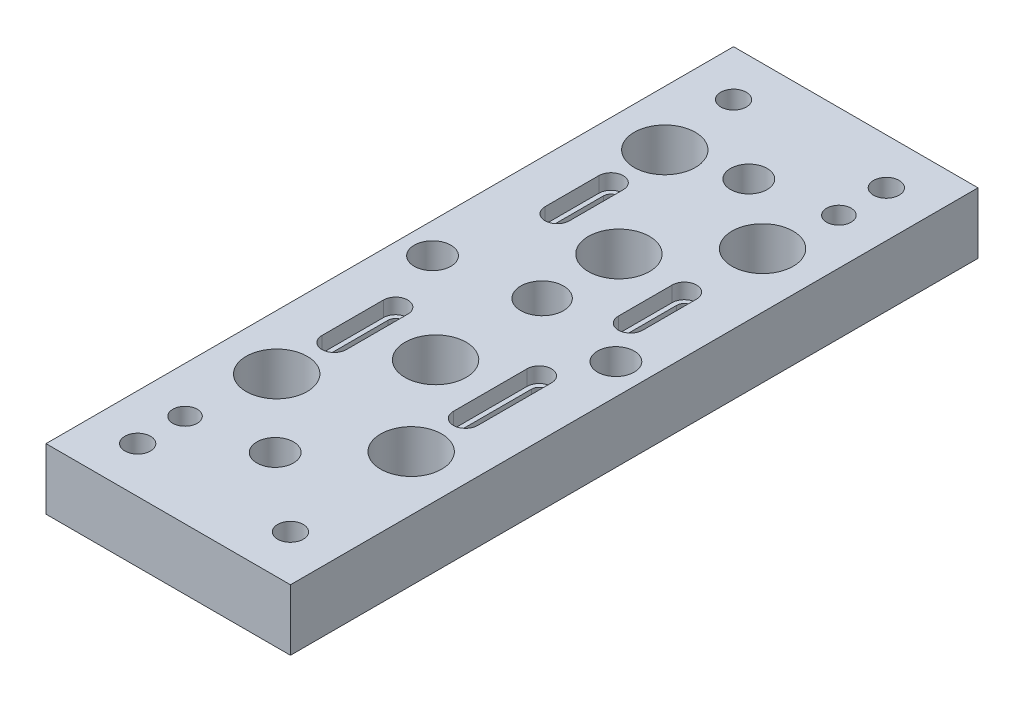
from build123d import *

# Parameters (mm, degrees)
SKETCH1_W                                    = 80
SKETCH1_H                                    = 225
BOSS_EXTRUDE1_DEPTH                          = 20
CUT_EXTRUDE1_REACH                           = 123.063
CUT_EXTRUDE2_DEPTH                           = 5
CBORE_FOR_M8_HEX_SOCKET_HEAD_CAP_SCR_2_COUNT = 2
CBORE_FOR_M8_HEX_SOCKET_HEAD_CAP_SCR_2_PITCH = 50
CBORE_FOR_M8_HEX_SOCKET_HEAD_CAP_SCR_3_COUNT = 2
CBORE_FOR_M8_HEX_SOCKET_HEAD_CAP_SCR_3_PITCH = 201.308221392
CBORE_FOR_M8_HEX_SOCKET_HEAD_CAP_SCR_4_COUNT = 2
CBORE_FOR_M8_HEX_SOCKET_HEAD_CAP_SCR_4_PITCH = 195
F_8_0MM_DOWEL_HOLE1_D                        = 8
SKETCH11_R                                   = 10
CUT_EXTRUDE3_DEPTH                           = 122.063000128
CUT_EXTRUDE4_REACH                           = 123.063
SKETCH13_R                                   = 6
CUT_EXTRUDE5_REACH                           = 123.063
SKETCH14_R                                   = 7


with BuildPart() as part:
    # Sketch1 → Boss-Extrude1 (new body)
    with BuildSketch(Plane(origin=(0, 0, 0), x_dir=(1, 0, 0), z_dir=(0, 1, 0))):
        Rectangle(SKETCH1_W, SKETCH1_H)
    extrude(amount=-BOSS_EXTRUDE1_DEPTH)

    # Sketch2 → Cut-Extrude1 (cut, up to next)
    with BuildSketch(Plane(origin=(0, 0, 0), x_dir=(1, 0, 0), z_dir=(0, 1, 0)), mode=Mode.PRIVATE) as cut_extrude1_sk1:
        with BuildLine():
            Line((24, 17.31), (24, 34.91))
            ThreePointArc((24, 34.91), (21.5, 37.41), (19, 34.91))
            Line((19, 34.91), (19, 17.31))
            ThreePointArc((19, 17.31), (21.5, 14.81), (24, 17.31))
        make_face()
    cut_extrude1_tool1 = extrude(cut_extrude1_sk1.sketch, amount=-CUT_EXTRUDE1_REACH, mode=Mode.PRIVATE) & part.part
    # Sketch2 → Cut-Extrude1 (cut, up to next)
    with BuildSketch(Plane(origin=(0, 0, 0), x_dir=(1, 0, 0), z_dir=(0, 1, 0)), mode=Mode.PRIVATE) as cut_extrude1_sk2:
        with BuildLine():
            Line((24, -36.69), (24, -12.59))
            ThreePointArc((24, -12.59), (21.5, -10.09), (19, -12.59))
            Line((19, -12.59), (19, -36.69))
            ThreePointArc((19, -36.69), (21.5, -39.19), (24, -36.69))
        make_face()
    cut_extrude1_tool2 = extrude(cut_extrude1_sk2.sketch, amount=-CUT_EXTRUDE1_REACH, mode=Mode.PRIVATE) & part.part
    # Sketch2 → Cut-Extrude1 (cut, up to next)
    with BuildSketch(Plane(origin=(0, 0, 0), x_dir=(1, 0, 0), z_dir=(0, 1, 0)), mode=Mode.PRIVATE) as cut_extrude1_sk3:
        with BuildLine():
            Line((-24, -16.59), (-24, -36.69))
            ThreePointArc((-24, -36.69), (-21.5, -39.19), (-19, -36.69))
            Line((-19, -36.69), (-19, -16.59))
            ThreePointArc((-19, -16.59), (-21.5, -14.09), (-24, -16.59))
        make_face()
    cut_extrude1_tool3 = extrude(cut_extrude1_sk3.sketch, amount=-CUT_EXTRUDE1_REACH, mode=Mode.PRIVATE) & part.part
    # Sketch2 → Cut-Extrude1 (cut, up to next)
    with BuildSketch(Plane(origin=(0, 0, 0), x_dir=(1, 0, 0), z_dir=(0, 1, 0)), mode=Mode.PRIVATE) as cut_extrude1_sk4:
        with BuildLine():
            Line((-24, 53.91), (-24, 36.31))
            ThreePointArc((-24, 36.31), (-21.5, 33.81), (-19, 36.31))
            Line((-19, 36.31), (-19, 53.91))
            ThreePointArc((-19, 53.91), (-21.5, 56.41), (-24, 53.91))
        make_face()
    cut_extrude1_tool4 = extrude(cut_extrude1_sk4.sketch, amount=-CUT_EXTRUDE1_REACH, mode=Mode.PRIVATE) & part.part
    add(cut_extrude1_tool1.solids().sort_by_distance((21.5, 0, -26.11))[0], mode=Mode.SUBTRACT)
    add(cut_extrude1_tool2.solids().sort_by_distance((21.5, 0, 24.64))[0], mode=Mode.SUBTRACT)
    add(cut_extrude1_tool3.solids().sort_by_distance((-21.5, 0, 26.64))[0], mode=Mode.SUBTRACT)
    add(cut_extrude1_tool4.solids().sort_by_distance((-21.5, 0, -45.11))[0], mode=Mode.SUBTRACT)

    # Sketch3 → Cut-Extrude2 (cut)
    with BuildSketch(Plane(origin=(0, 0, 0), x_dir=(1, 0, 0), z_dir=(0, 1, 0))):
        with BuildLine():
            Line((-17.5, 36.31), (-17.5, 53.91))
            ThreePointArc((-17.5, 53.91), (-21.5, 57.91), (-25.5, 53.91))
            Line((-25.5, 53.91), (-25.5, 36.31))
            ThreePointArc((-25.5, 36.31), (-21.5, 32.31), (-17.5, 36.31))
        make_face()
        with BuildLine():
            Line((25.5, 17.31), (25.5, 34.91))
            ThreePointArc((25.5, 34.91), (21.5, 38.91), (17.5, 34.91))
            Line((17.5, 34.91), (17.5, 17.31))
            ThreePointArc((17.5, 17.31), (21.5, 13.31), (25.5, 17.31))
        make_face()
        with BuildLine():
            Line((25.5, -36.69), (25.5, -12.59))
            ThreePointArc((25.5, -12.59), (21.5, -8.59), (17.5, -12.59))
            Line((17.5, -12.59), (17.5, -36.69))
            ThreePointArc((17.5, -36.69), (21.5, -40.69), (25.5, -36.69))
        make_face()
        with BuildLine():
            Line((-25.5, -16.59), (-25.5, -36.69))
            ThreePointArc((-25.5, -36.69), (-21.5, -40.69), (-17.5, -36.69))
            Line((-17.5, -36.69), (-17.5, -16.59))
            ThreePointArc((-17.5, -16.59), (-21.5, -12.59), (-25.5, -16.59))
        make_face()
    extrude(amount=-CUT_EXTRUDE2_DEPTH, mode=Mode.SUBTRACT)

    # Sketch6 → CBORE for M8 Hex Socket Head Cap Screw1 (revolve, cut)
    with BuildSketch(Plane(origin=(25, -20, -97.5), x_dir=(0, 0, -1), z_dir=(1, 0, 0))):
        Polygon((0, 0), (0, 20), (4.2, 20), (4.2, 8.6), (7.5, 8.6), (7.5, 0.025), (7.525, 0), align=None)
    cbore_for_m8_hex_socket_head_cap_screw1 = revolve(axis=Axis((25, -26.35, -97.5), (0, 1, 0)), mode=Mode.SUBTRACT)

    # CBORE for M8 Hex Socket Head Cap Scr 2: CBORE for M8 Hex Socket Head Cap Screw1 ×2
    with Locations(*[(-i * CBORE_FOR_M8_HEX_SOCKET_HEAD_CAP_SCR_2_PITCH, 0, 0) for i in range(1, CBORE_FOR_M8_HEX_SOCKET_HEAD_CAP_SCR_2_COUNT)]):
        add(cbore_for_m8_hex_socket_head_cap_screw1, mode=Mode.SUBTRACT)

    # CBORE for M8 Hex Socket Head Cap Scr 3: CBORE for M8 Hex Socket Head Cap Screw1 ×2
    with Locations(*[Vector(-0.24837535026770385, 0, 0.968663866044045) * (i * CBORE_FOR_M8_HEX_SOCKET_HEAD_CAP_SCR_3_PITCH) for i in range(1, CBORE_FOR_M8_HEX_SOCKET_HEAD_CAP_SCR_3_COUNT)]):
        add(cbore_for_m8_hex_socket_head_cap_screw1, mode=Mode.SUBTRACT)

    # CBORE for M8 Hex Socket Head Cap Scr 4: CBORE for M8 Hex Socket Head Cap Screw1 ×2
    with Locations(*[(0, 0, i * CBORE_FOR_M8_HEX_SOCKET_HEAD_CAP_SCR_4_PITCH) for i in range(1, CBORE_FOR_M8_HEX_SOCKET_HEAD_CAP_SCR_4_COUNT)]):
        add(cbore_for_m8_hex_socket_head_cap_screw1, mode=Mode.SUBTRACT)

    # Ø8.0mm Dowel Hole1 (through all)
    with Locations(Plane(origin=(0, -20, 0), x_dir=(-1, 0, 0), z_dir=(0, -1, 0))):
        with Locations((-25, 81.975), (25, -82)):
            Hole(F_8_0MM_DOWEL_HOLE1_D / 2)

    # Sketch11 → Cut-Extrude3 (cut, through all)
    with BuildSketch(Plane.XZ.offset(20)):
        with Locations((-22, 55)):
            Circle(SKETCH11_R)
        with Locations((22, 55)):
            Circle(SKETCH11_R)
        with Locations((-22, -72)):
            Circle(SKETCH11_R)
        with Locations((22, -60)):
            Circle(SKETCH11_R)
        with Locations((0, -35)):
            Circle(SKETCH11_R)
        with Locations((0, 25)):
            Circle(SKETCH11_R)
    extrude(amount=-CUT_EXTRUDE3_DEPTH, mode=Mode.SUBTRACT)

    # Sketch13 → Cut-Extrude4 (cut, up to next)
    with BuildSketch(Plane(origin=(0, 0, 0), x_dir=(1, 0, 0), z_dir=(0, 1, 0)), mode=Mode.PRIVATE) as cut_extrude4_sk1:
        with Locations((0, 77.5)):
            Circle(SKETCH13_R)
    cut_extrude4_tool1 = extrude(cut_extrude4_sk1.sketch, amount=-CUT_EXTRUDE4_REACH, mode=Mode.PRIVATE) & part.part
    # Sketch13 → Cut-Extrude4 (cut, up to next)
    with BuildSketch(Plane(origin=(0, 0, 0), x_dir=(1, 0, 0), z_dir=(0, 1, 0)), mode=Mode.PRIVATE) as cut_extrude4_sk2:
        with Locations((0, -77.5)):
            Circle(SKETCH13_R)
    cut_extrude4_tool2 = extrude(cut_extrude4_sk2.sketch, amount=-CUT_EXTRUDE4_REACH, mode=Mode.PRIVATE) & part.part
    # Sketch13 → Cut-Extrude4 (cut, up to next)
    with BuildSketch(Plane(origin=(0, 0, 0), x_dir=(1, 0, 0), z_dir=(0, 1, 0)), mode=Mode.PRIVATE) as cut_extrude4_sk3:
        with Locations((-30, 4)):
            Circle(SKETCH13_R)
    cut_extrude4_tool3 = extrude(cut_extrude4_sk3.sketch, amount=-CUT_EXTRUDE4_REACH, mode=Mode.PRIVATE) & part.part
    # Sketch13 → Cut-Extrude4 (cut, up to next)
    with BuildSketch(Plane(origin=(0, 0, 0), x_dir=(1, 0, 0), z_dir=(0, 1, 0)), mode=Mode.PRIVATE) as cut_extrude4_sk4:
        with Locations((30, 4)):
            Circle(SKETCH13_R)
    cut_extrude4_tool4 = extrude(cut_extrude4_sk4.sketch, amount=-CUT_EXTRUDE4_REACH, mode=Mode.PRIVATE) & part.part
    add(cut_extrude4_tool1.solids().sort_by_distance((0, 0, -77.5))[0], mode=Mode.SUBTRACT)
    add(cut_extrude4_tool2.solids().sort_by_distance((0, 0, 77.5))[0], mode=Mode.SUBTRACT)
    add(cut_extrude4_tool3.solids().sort_by_distance((-30, 0, -4))[0], mode=Mode.SUBTRACT)
    add(cut_extrude4_tool4.solids().sort_by_distance((30, 0, -4))[0], mode=Mode.SUBTRACT)

    # Sketch14 → Cut-Extrude5 (cut, up to next)
    with BuildSketch(Plane(origin=(0, 0, 0), x_dir=(1, 0, 0), z_dir=(0, 1, 0)), mode=Mode.PRIVATE) as cut_extrude5_sk1:
        with Locations((0, 9.86)):
            Circle(SKETCH14_R)
    cut_extrude5_tool1 = extrude(cut_extrude5_sk1.sketch, amount=-CUT_EXTRUDE5_REACH, mode=Mode.PRIVATE) & part.part
    add(cut_extrude5_tool1.solids().sort_by_distance((0, 0, -9.86))[0], mode=Mode.SUBTRACT)


solid = part.part
